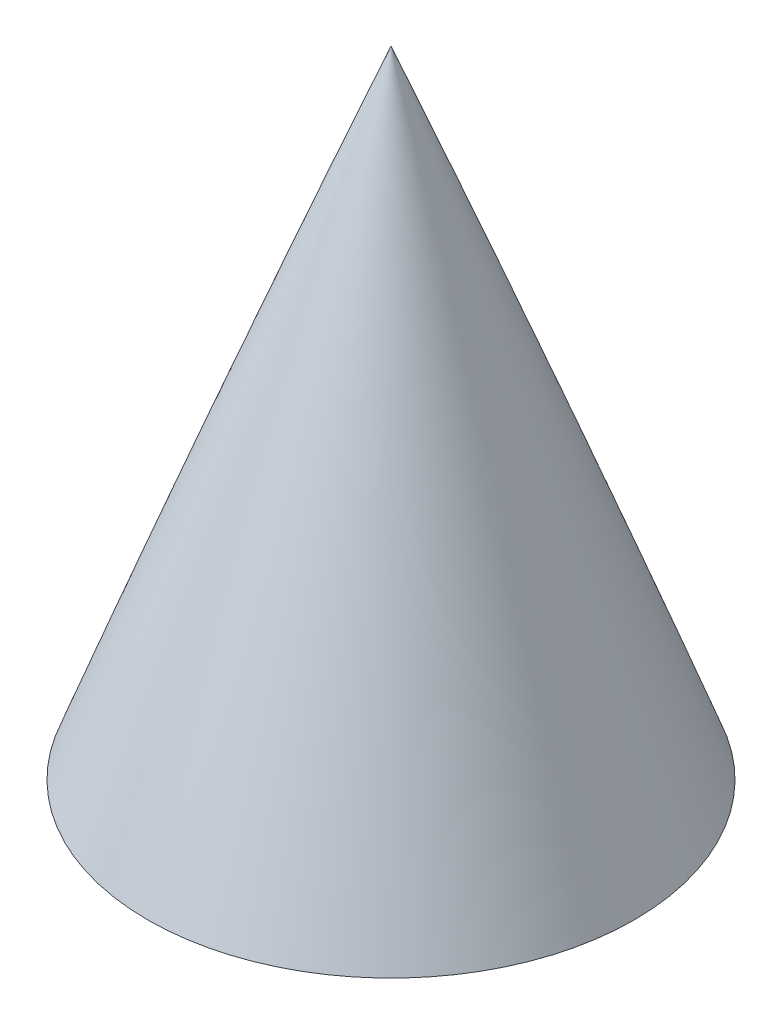
from build123d import *

# Parameters (mm, degrees)
SKETCH7_R          = 421.495799584
CUT_EXTRUDE2_DEPTH = 330.2
SKETCH8_R          = 2.413
CUT_EXTRUDE3_DEPTH = 12.7


with BuildPart() as part:
    # Sketch2 → Revolve1 (revolve)
    with BuildSketch(Plane.XY):
        with BuildLine():
            Line((-76.2, 0), (-69.85, 0))
            Line((-69.85, 0), (0, 0))
            Line((0, 0), (0, 350.52))
            Line((0, 350.52), (0, 355.6))
            ThreePointArc((0, 355.6), (-52.988589627, 180.990412063), (-76.2, 0))
        make_face()
    revolve(axis=Axis((0, 355.6, 0), (0, -1, 0)))

    # Sketch7 → Cut-Extrude2 (cut)
    with BuildSketch(Plane.XZ):
        with Locations((-188.314971498, 83.017725001)):
            Circle(SKETCH7_R)
    extrude(amount=-CUT_EXTRUDE2_DEPTH, mode=Mode.SUBTRACT)

    # Sketch8 → Cut-Extrude3 (cut)
    with BuildSketch(Plane(origin=(0, 330.2, 0), x_dir=(-1, 0, 0), z_dir=(0, -1, 0))):
        Circle(SKETCH8_R)
    extrude(amount=-CUT_EXTRUDE3_DEPTH, mode=Mode.SUBTRACT)


solid = part.part
